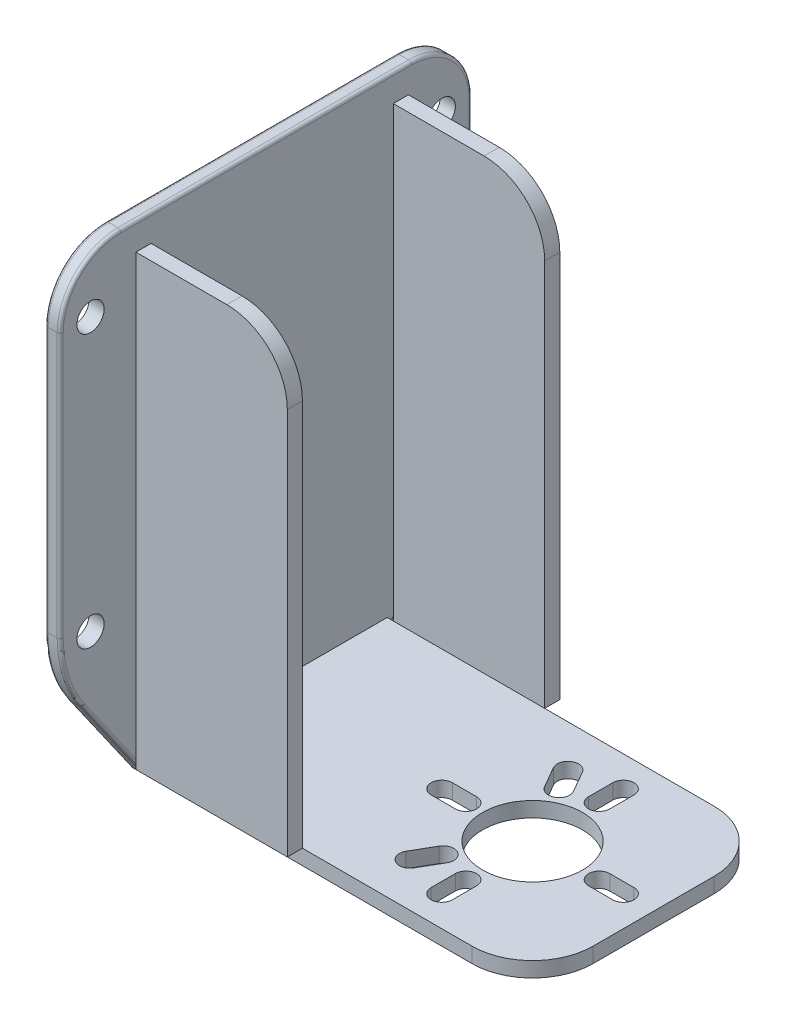
from build123d import *

# Parameters (mm, degrees)
SKETCH_1_W          = 64
SKETCH_1_H          = 40
SKETCH_1_R          = 8.25
EXTRUDE_1_DEPTH     = 2.5
EXTRUDE_2_DEPTH     = 2.5
SKETCH_6_W          = 2.5
SKETCH_6_H          = 68.008301529
EXTRUDE_3_DEPTH     = 60
SKETCH_7_R          = 2.25
CUT_EXTRUDE_1_DEPTH = 123.347999271
FILLET_1_R          = 10
FILLET_2_R          = 20
FILLET_4_R          = 10
FILLET_12_R         = 0.5
FILLET_13_R         = 0.5
SKETCH_8_W          = 25
SKETCH_8_H          = 2.5
EXTRUDE_5_DEPTH     = 74
EXTRUDE_5_2_DEPTH   = 74
FILLET_14_R         = 10
FILLET_15_R         = 10


with BuildPart() as part:
    # 草图1 → 凸台-拉伸1 (new body)
    with BuildSketch(Plane(origin=(0, 0, 0), x_dir=(1, 0, 0), z_dir=(0, 1, 0))):
        with Locations((-45.647943628, 32.876585816)):
            Rectangle(SKETCH_1_W, SKETCH_1_H)
        with Locations((-33.647943628, 32.876585816)):
            Circle(SKETCH_1_R, mode=Mode.SUBTRACT)
        with BuildLine():
            Line((-18.647943628, 31.126585816), (-22.647943628, 31.126585816))
            ThreePointArc((-22.647943628, 31.126585816), (-24.397943628, 32.876585816), (-22.647943628, 34.626585816))
            Line((-22.647943628, 34.626585816), (-18.647943628, 34.626585816))
            ThreePointArc((-18.647943628, 34.626585816), (-16.897943628, 32.876585816), (-18.647943628, 31.126585816))
        make_face(mode=Mode.SUBTRACT)
        with BuildLine():
            Line((-35.397943628, 17.876585816), (-35.397943628, 21.876585816))
            ThreePointArc((-35.397943628, 21.876585816), (-33.647943628, 23.626585816), (-31.897943628, 21.876585816))
            Line((-31.897943628, 21.876585816), (-31.897943628, 17.876585816))
            ThreePointArc((-31.897943628, 17.876585816), (-33.647943628, 16.126585816), (-35.397943628, 17.876585816))
        make_face(mode=Mode.SUBTRACT)
        with BuildLine():
            Line((-48.647943628, 34.626585816), (-44.647943628, 34.626585816))
            ThreePointArc((-44.647943628, 34.626585816), (-42.897943628, 32.876585816), (-44.647943628, 31.126585816))
            Line((-44.647943628, 31.126585816), (-48.647943628, 31.126585816))
            ThreePointArc((-48.647943628, 31.126585816), (-50.397943628, 32.876585816), (-48.647943628, 34.626585816))
        make_face(mode=Mode.SUBTRACT)
        with BuildLine():
            Line((-31.897943628, 47.876585816), (-31.897943628, 43.876585816))
            ThreePointArc((-31.897943628, 43.876585816), (-33.647943628, 42.126585816), (-35.397943628, 43.876585816))
            Line((-35.397943628, 43.876585816), (-35.397943628, 47.876585816))
            ThreePointArc((-35.397943628, 47.876585816), (-33.647943628, 49.626585816), (-31.897943628, 47.876585816))
        make_face(mode=Mode.SUBTRACT)
        with BuildLine():
            Line((-42.663488085, 21.01120476), (-40.663488085, 24.475306375))
            ThreePointArc((-40.663488085, 24.475306375), (-38.272943628, 25.115850831), (-37.632399171, 22.725306375))
            Line((-37.632399171, 22.725306375), (-39.632399171, 19.26120476))
            ThreePointArc((-39.632399171, 19.26120476), (-42.022943628, 18.620660303), (-42.663488085, 21.01120476))
        make_face(mode=Mode.SUBTRACT)
        with BuildLine():
            Line((-39.41589282, 46.866966873), (-37.41589282, 43.402865258))
            ThreePointArc((-37.41589282, 43.402865258), (-38.056437277, 41.012320801), (-40.446981734, 41.652865258))
            Line((-40.446981734, 41.652865258), (-42.446981734, 45.116966873))
            ThreePointArc((-42.446981734, 45.116966873), (-41.806437277, 47.50751133), (-39.41589282, 46.866966873))
        make_face(mode=Mode.SUBTRACT)
    extrude(amount=EXTRUDE_1_DEPTH)

    # 草图2 → 凸台-拉伸2 (add)
    with BuildSketch(Plane.ZY.offset(77.647943628)):
        Polygon((-66.880736581, 20), (-52.876585816, 0), (-12.876585816, 0), (1.127564948, 20), align=None)
    extrude(amount=EXTRUDE_2_DEPTH)

    # 草图6 → 凸台-拉伸3 (add)
    with BuildSketch(Plane(origin=(0, 20, 0), x_dir=(1, 0, 0), z_dir=(0, 1, 0))):
        with Locations((-78.897943628, 32.876585817)):
            Rectangle(SKETCH_6_W, SKETCH_6_H)
    extrude(amount=EXTRUDE_3_DEPTH)

    # 草图7 → 切除-拉伸1 (cut, through all)
    with BuildSketch(Plane(origin=(-77.647943628, 0, 0), x_dir=(0, 0, -1), z_dir=(1, 0, 0))):
        with Locations((61.876585816, 25)):
            Circle(SKETCH_7_R)
        with Locations((3.876585816, 25)):
            Circle(SKETCH_7_R)
        with Locations((61.876585816, 70)):
            Circle(SKETCH_7_R)
        with Locations((3.876585816, 70)):
            Circle(SKETCH_7_R)
    extrude(amount=-CUT_EXTRUDE_1_DEPTH, mode=Mode.SUBTRACT)

    # 圆角1
    fillet_1_edges = [part.edges().sort_by_distance(p)[0] for p in [
        (-13.647943628, 1.25, -12.876585816),
        (-13.647943628, 1.25, -52.876585816),
    ]]
    fillet(fillet_1_edges, radius=FILLET_1_R)

    # 圆角2
    fillet_2_edges = [part.edges().sort_by_distance(p)[0] for p in [
        (-78.897943628, 20, -66.880736581),
        (-78.897943628, 20, 1.127564948),
    ]]
    fillet(fillet_2_edges, radius=FILLET_2_R)

    # 圆角4
    fillet_4_edges = [part.edges().sort_by_distance(p)[0] for p in [
        (-78.897943628, 80, 1.127564948),
        (-78.897943628, 80, -66.880736581),
    ]]
    fillet(fillet_4_edges, radius=FILLET_4_R)

    # 圆角12
    fillet_12_edges = [part.edges().sort_by_distance(p)[0] for p in [
        (-77.647943628, 7.417223525, -58.070181641),
        (-77.647943628, 20.291859787, -65.955075596),
        (-77.647943628, 48.152987889, -66.880736581),
        (-77.647943628, 77.071067812, -63.951804393),
        (-77.647943628, 80, -32.876585816),
        (-77.647943628, 77.071067812, -1.80136724),
        (-77.647943628, 7.417223525, -7.682989991),
        (-77.647943628, 20.291859787, 0.201903963),
        (-77.647943628, 48.152987889, 1.127564948),
    ]]
    fillet(fillet_12_edges, radius=FILLET_12_R)

    # 圆角13
    fillet_13_edges = [part.edges().sort_by_distance(p)[0] for p in [
        (-80.147943628, 7.417223525, -58.070181641),
        (-80.147943628, 20.291859787, -65.955075596),
        (-80.147943628, 48.152987889, -66.880736581),
        (-80.147943628, 77.071067812, -63.951804393),
        (-80.147943628, 80, -32.876585816),
        (-80.147943628, 77.071067812, -1.80136724),
        (-80.147943628, 7.417223525, -7.682989991),
        (-80.147943628, 20.291859787, 0.201903963),
        (-80.147943628, 48.152987889, 1.127564948),
    ]]
    fillet(fillet_13_edges, radius=FILLET_13_R)


with BuildPart() as body_2:
    # 草图8 → 凸台-拉伸5 (new body)
    with BuildSketch(Plane(origin=(0, 2.5, 0), x_dir=(1, 0, 0), z_dir=(0, 1, 0))):
        with Locations((-64.147943628, 54.126585816)):
            Rectangle(SKETCH_8_W, SKETCH_8_H)
    extrude(amount=EXTRUDE_5_DEPTH)

    # 圆角14
    fillet_14_edges = [body_2.edges().sort_by_distance(p)[0] for p in [
        (-51.647943628, 76.5, -54.126585816),
    ]]
    fillet(fillet_14_edges, radius=FILLET_14_R)


with BuildPart() as body_3:
    # 草图8 → Extrude 5 2 (new body)
    with BuildSketch(Plane(origin=(0, 2.5, 0), x_dir=(1, 0, 0), z_dir=(0, 1, 0))):
        with Locations((-64.147943628, 11.626585816)):
            Rectangle(SKETCH_8_W, SKETCH_8_H)
    extrude(amount=EXTRUDE_5_2_DEPTH)

    # 圆角15
    fillet_15_edges = [body_3.edges().sort_by_distance(p)[0] for p in [
        (-51.647943628, 76.5, -11.626585816),
    ]]
    fillet(fillet_15_edges, radius=FILLET_15_R)


solid = Compound([part.part, body_2.part, body_3.part])
